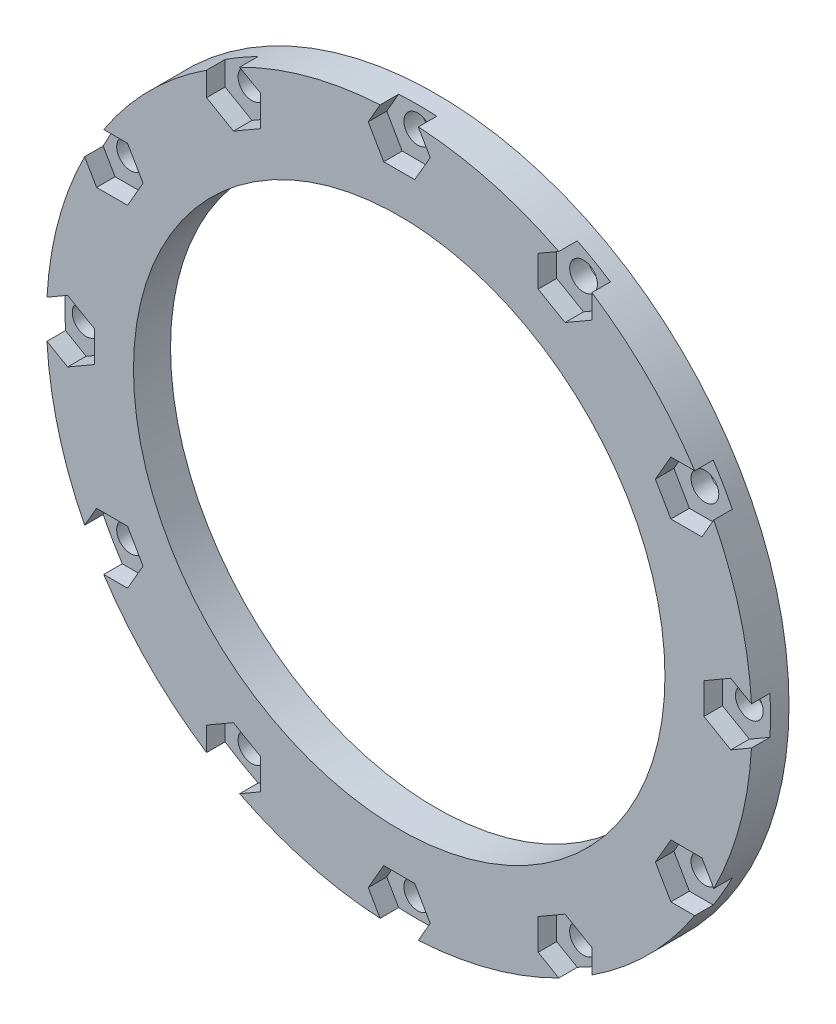
from build123d import *

# Parameters (mm, degrees)
SKETCH1_R           = 38.1
SKETCH1_R_2         = 28.702
BOSS_EXTRUDE1_DEPTH = 4
SKETCH2_R           = 1.5
CUT_EXTRUDE1_DEPTH  = 55.029806589
CUT_EXTRUDE3_DEPTH  = 2


with BuildPart() as part:
    # Sketch1 → Boss-Extrude1 (new body)
    with BuildSketch(Plane.XY):
        Circle(SKETCH1_R)
        Circle(SKETCH1_R_2, mode=Mode.SUBTRACT)
    extrude(amount=BOSS_EXTRUDE1_DEPTH)

    # Sketch2 → Cut-Extrude1 (cut, through all)
    with BuildSketch(Plane.XY.offset(4)):
        with Locations((0, 35.814)):
            Circle(SKETCH2_R)
        with Locations((17.907, 31.015833811)):
            Circle(SKETCH2_R)
        with Locations((31.015833811, 17.907)):
            Circle(SKETCH2_R)
        with Locations((35.814, 0)):
            Circle(SKETCH2_R)
        with Locations((31.015833811, -17.907)):
            Circle(SKETCH2_R)
        with Locations((17.907, -31.015833811)):
            Circle(SKETCH2_R)
        with Locations((0, -35.814)):
            Circle(SKETCH2_R)
        with Locations((-17.907, -31.015833811)):
            Circle(SKETCH2_R)
        with Locations((-31.015833811, -17.907)):
            Circle(SKETCH2_R)
        with Locations((-35.814, 0)):
            Circle(SKETCH2_R)
        with Locations((-31.015833811, 17.907)):
            Circle(SKETCH2_R)
        with Locations((-17.907, 31.015833811)):
            Circle(SKETCH2_R)
    extrude(amount=-CUT_EXTRUDE1_DEPTH, mode=Mode.SUBTRACT)

    # Sketch4 → Cut-Extrude3 (cut)
    with BuildSketch(Plane.XY.offset(4)):
        Polygon((20.807, 29.34151803), (20.807, 32.690149592), (17.907, 34.364465372), (15.007, 32.690149592), (15.007, 29.34151803), (17.907, 27.66720225), align=None)
        Polygon((3.348631561, 35.814), (1.674315781, 38.714), (-1.674315781, 38.714), (-3.348631561, 35.814), (-1.674315781, 32.914), (1.674315781, 32.914), align=None)
        Polygon((32.690149592, 15.007), (34.364465372, 17.907), (32.690149592, 20.807), (29.34151803, 20.807), (27.66720225, 17.907), (29.34151803, 15.007), align=None)
        Polygon((35.814, -3.348631561), (38.714, -1.674315781), (38.714, 1.674315781), (35.814, 3.348631561), (32.914, 1.674315781), (32.914, -1.674315781), align=None)
        Polygon((29.34151803, -20.807), (32.690149592, -20.807), (34.364465372, -17.907), (32.690149592, -15.007), (29.34151803, -15.007), (27.66720225, -17.907), align=None)
        Polygon((15.007, -32.690149592), (17.907, -34.364465372), (20.807, -32.690149592), (20.807, -29.34151803), (17.907, -27.66720225), (15.007, -29.34151803), align=None)
        Polygon((-3.348631561, -35.814), (-1.674315781, -38.714), (1.674315781, -38.714), (3.348631561, -35.814), (1.674315781, -32.914), (-1.674315781, -32.914), align=None)
        Polygon((-20.807, -29.34151803), (-20.807, -32.690149592), (-17.907, -34.364465372), (-15.007, -32.690149592), (-15.007, -29.34151803), (-17.907, -27.66720225), align=None)
        Polygon((-32.690149592, -15.007), (-34.364465372, -17.907), (-32.690149592, -20.807), (-29.34151803, -20.807), (-27.66720225, -17.907), (-29.34151803, -15.007), align=None)
        Polygon((-35.814, 3.348631561), (-38.714, 1.674315781), (-38.714, -1.674315781), (-35.814, -3.348631561), (-32.914, -1.674315781), (-32.914, 1.674315781), align=None)
        Polygon((-29.34151803, 20.807), (-32.690149592, 20.807), (-34.364465372, 17.907), (-32.690149592, 15.007), (-29.34151803, 15.007), (-27.66720225, 17.907), align=None)
        Polygon((-15.007, 32.690149592), (-17.907, 34.364465372), (-20.807, 32.690149592), (-20.807, 29.34151803), (-17.907, 27.66720225), (-15.007, 29.34151803), align=None)
    extrude(amount=-CUT_EXTRUDE3_DEPTH, mode=Mode.SUBTRACT)


solid = part.part
